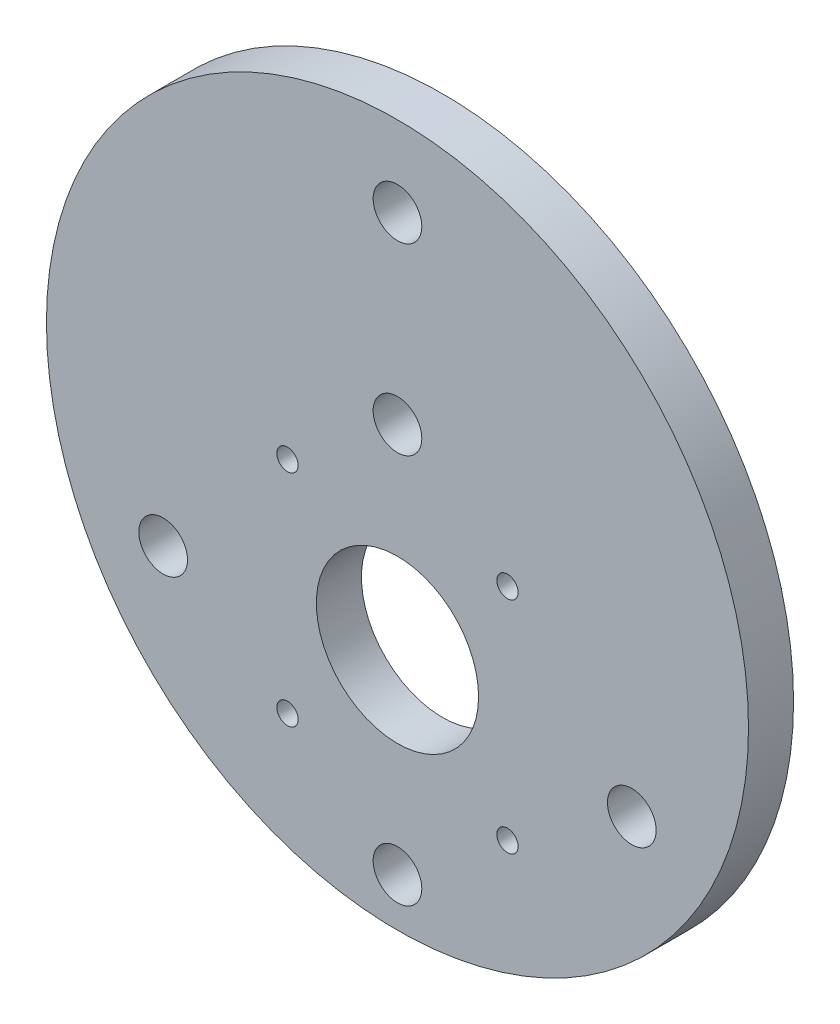
from build123d import *

# Parameters (mm, degrees)
SKETCH1_R                        = 49.4665
BOSS_EXTRUDE1_DEPTH              = 6.35
M3_SCREW_HOLE_3_0MM_DOWEL_HOLE_D = 3
SKETCH5_R                        = 3.429
CUT_EXTRUDE1_DEPTH               = 71.243802179
SKETCH6_R                        = 3.429
CUT_EXTRUDE2_DEPTH               = 71.243802179
SKETCH7_R                        = 11.43
CUT_EXTRUDE3_DEPTH               = 71.243802179


with BuildPart() as part:
    # Sketch1 → Boss-Extrude1 (new body)
    with BuildSketch(Plane.XY):
        Circle(SKETCH1_R)
    extrude(amount=BOSS_EXTRUDE1_DEPTH)

    # M3 Screw Hole - Ø3.0mm Dowel Hole (through all)
    with Locations(Plane.XY.offset(6.35)):
        with Locations((15.5, 0.26), (-15.5, 0.26), (-15.5, -30.74), (15.5, -30.74)):
            Hole(M3_SCREW_HOLE_3_0MM_DOWEL_HOLE_D / 2)

    # Sketch5 → Cut-Extrude1 (cut, through all)
    with BuildSketch(Plane.XY.offset(6.35)):
        with Locations((0, -42.672)):
            Circle(SKETCH5_R)
        with Locations((0, 12.26)):
            Circle(SKETCH5_R)
    extrude(amount=-CUT_EXTRUDE1_DEPTH, mode=Mode.SUBTRACT)

    # Sketch6 → Cut-Extrude2 (cut, through all)
    with BuildSketch(Plane.XY.offset(6.35)):
        with Locations((0, 38.128211777)):
            Circle(SKETCH6_R)
        with Locations((-33.02, -19.064105889)):
            Circle(SKETCH6_R)
        with Locations((33.02, -19.064105889)):
            Circle(SKETCH6_R)
    extrude(amount=-CUT_EXTRUDE2_DEPTH, mode=Mode.SUBTRACT)

    # Sketch7 → Cut-Extrude3 (cut, through all)
    with BuildSketch(Plane.XY.offset(6.35)):
        with Locations((0, -15.24)):
            Circle(SKETCH7_R)
    extrude(amount=-CUT_EXTRUDE3_DEPTH, mode=Mode.SUBTRACT)


solid = part.part
